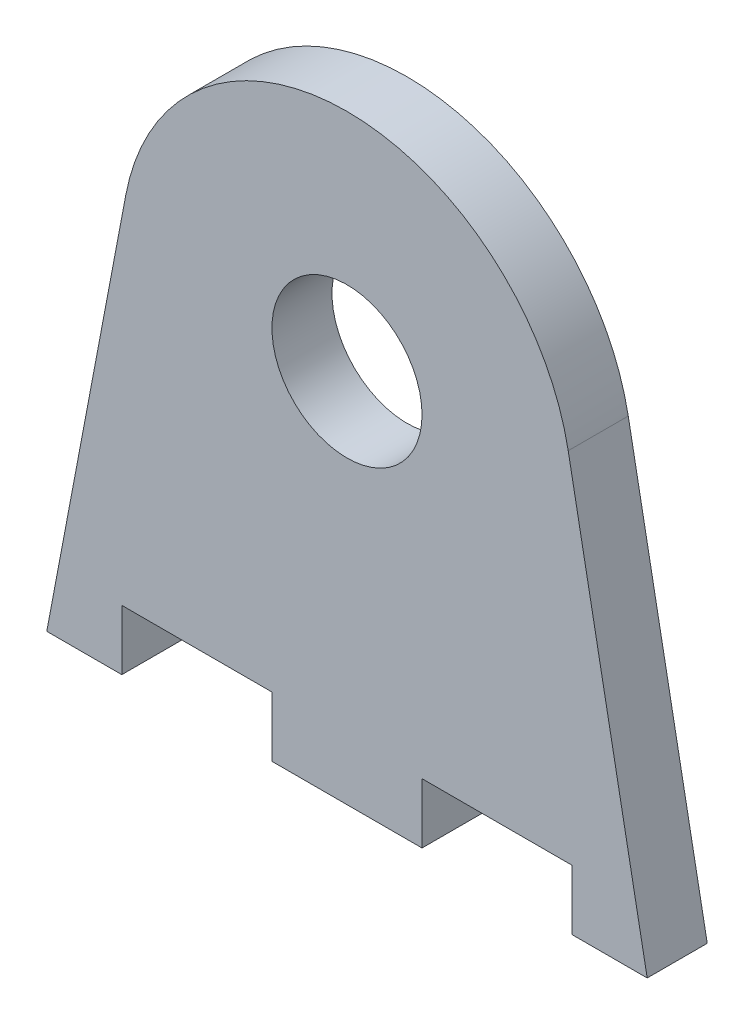
from build123d import *

# Parameters (mm, degrees)
SKETCH1_R           = 5
BOSS_EXTRUDE2_DEPTH = 4


with BuildPart() as part:
    # Sketch1 → Boss-Extrude2 (new body)
    with BuildSketch(Plane.XY):
        with BuildLine():
            Line((-20, -25), (-15, -25))
            Line((-15, -25), (-15, -21))
            Line((-15, -21), (-5, -21))
            Line((-5, -21), (-5, -25))
            Line((-5, -25), (5, -25))
            Line((5, -25), (5, -21))
            Line((5, -21), (15, -21))
            Line((15, -21), (15, -25))
            Line((15, -25), (20, -25))
            Line((20, -25), (14.738148017, 2.790518414))
            ThreePointArc((14.738148017, 2.790518414), (0, 15), (-14.738148017, 2.790518414))
            Line((-14.738148017, 2.790518414), (-20, -25))
        make_face()
        Circle(SKETCH1_R, mode=Mode.SUBTRACT)
    extrude(amount=BOSS_EXTRUDE2_DEPTH)


solid = part.part
